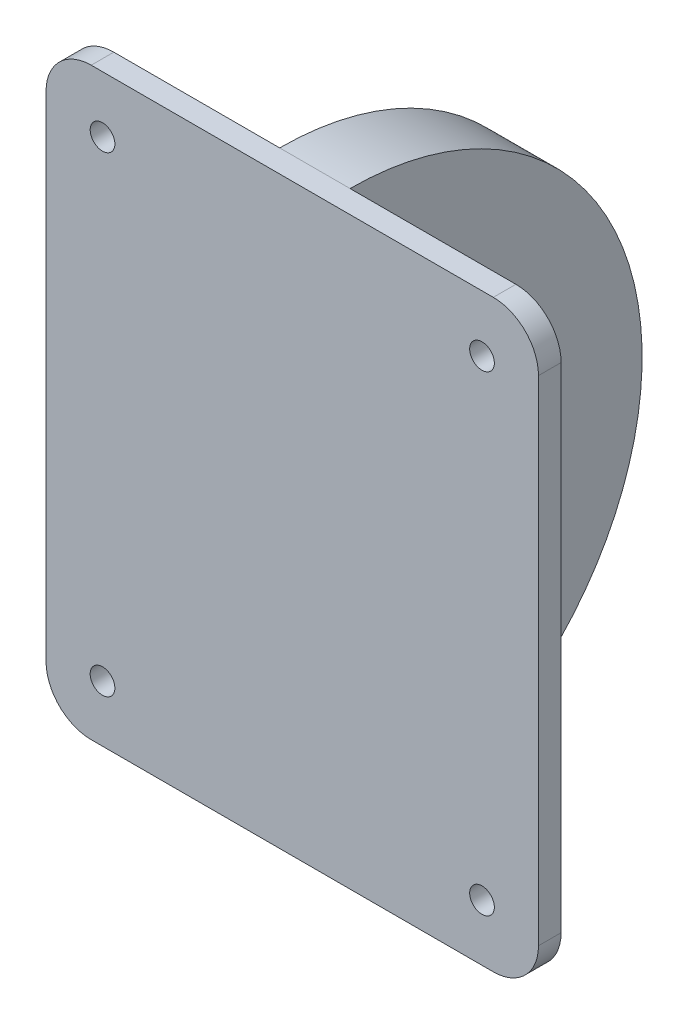
from build123d import *

# Parameters (mm, degrees)
SKETCH1_W           = 43.598
SKETCH1_H           = 51.7166
BOSS_EXTRUDE1_DEPTH = 2
FILLET1_R           = 4
SKETCH2_R           = 1.0922
CUT_EXTRUDE1_DEPTH  = 2
BOSS_EXTRUDE2_DEPTH = 3.116228855
CUT_EXTRUDE2_REACH  = 46.25
SKETCH6_R           = 5


with BuildPart() as part:
    # Sketch1 → Boss-Extrude1 (new body)
    with BuildSketch(Plane.XY):
        Rectangle(SKETCH1_W, SKETCH1_H)
    extrude(amount=BOSS_EXTRUDE1_DEPTH)

    # Fillet1
    fillet1_edges = [part.edges().sort_by_distance(p)[0] for p in [
        (-21.799, -25.8583, 1),
        (21.799, -25.8583, 1),
        (-21.799, 25.8583, 1),
        (21.799, 25.8583, 1),
    ]]
    fillet(fillet1_edges, radius=FILLET1_R)

    # Sketch2 → Cut-Extrude1 (cut)
    with BuildSketch(Plane.XY.offset(2)):
        with Locations((-16.799, 20.8583)):
            Circle(SKETCH2_R)
        with Locations((16.799, 20.8583)):
            Circle(SKETCH2_R)
        with Locations((-16.799, -20.8583)):
            Circle(SKETCH2_R)
        with Locations((16.799, -20.8583)):
            Circle(SKETCH2_R)
    extrude(amount=-CUT_EXTRUDE1_DEPTH, mode=Mode.SUBTRACT)

    # Sketch5 → Boss-Extrude2 (add, symmetric)
    with BuildSketch(Plane(origin=(0, 0, 0), x_dir=(0, 0, -1), z_dir=(1, 0, 0))):
        with BuildLine():
            Line((0, 25.8583), (0, -25.8583))
            ThreePointArc((0, -25.8583), (25.8583, 0), (0, 25.8583))
        make_face()
    extrude(amount=BOSS_EXTRUDE2_DEPTH, both=True)

    # Sketch6 → Cut-Extrude2 (cut, up to next)
    with BuildSketch(Plane(origin=(3.116228855, 0, 0), x_dir=(0, 0, -1), z_dir=(1, 0, 0)), mode=Mode.PRIVATE) as cut_extrude2_sk1:
        with Locations((10.61, 0)):
            Circle(SKETCH6_R)
    cut_extrude2_tool1 = extrude(cut_extrude2_sk1.sketch, amount=-CUT_EXTRUDE2_REACH, mode=Mode.PRIVATE) & part.part
    add(cut_extrude2_tool1.solids().sort_by_distance((3.116229, 0, -10.61))[0], mode=Mode.SUBTRACT)


solid = part.part
